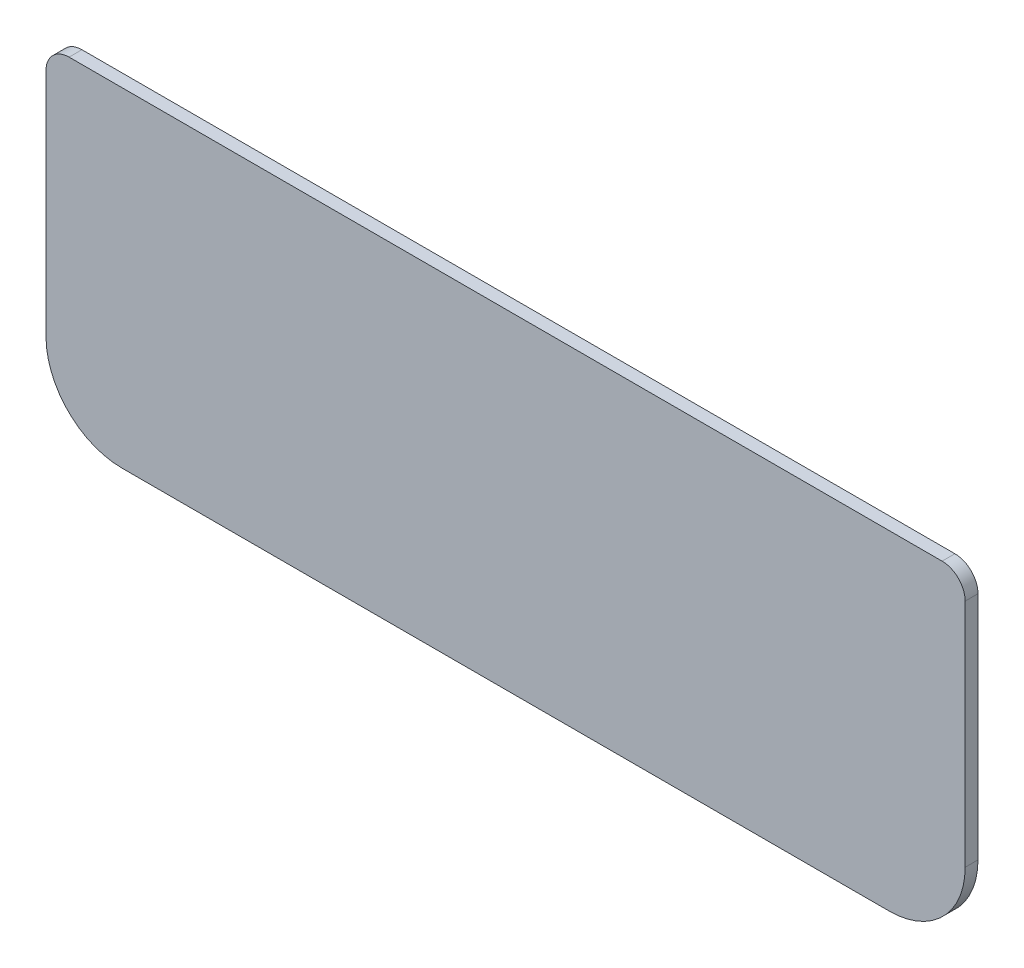
from build123d import *

# Parameters (mm, degrees)
BOSS_EXTRU_1_DEPTH = 2.5


with BuildPart() as part:
    # Esquisse20 → Boss.-Extru.1 (new body)
    with BuildSketch(Plane.XY):
        with BuildLine():
            Line((14.8, -2), (164.37, -2))
            ThreePointArc((164.37, -2), (174.835180362, 2.334819638), (179.17, 12.8))
            Line((179.17, 12.8), (179.17, 57.73))
            ThreePointArc((179.17, 57.73), (177.851980515, 60.911980515), (174.67, 62.23))
            Line((174.67, 62.23), (4.5, 62.23))
            ThreePointArc((4.5, 62.23), (1.318019485, 60.911980515), (0, 57.73))
            Line((0, 57.73), (0, 12.8))
            ThreePointArc((0, 12.8), (4.334819638, 2.334819638), (14.8, -2))
        make_face()
    extrude(amount=BOSS_EXTRU_1_DEPTH)


solid = part.part
